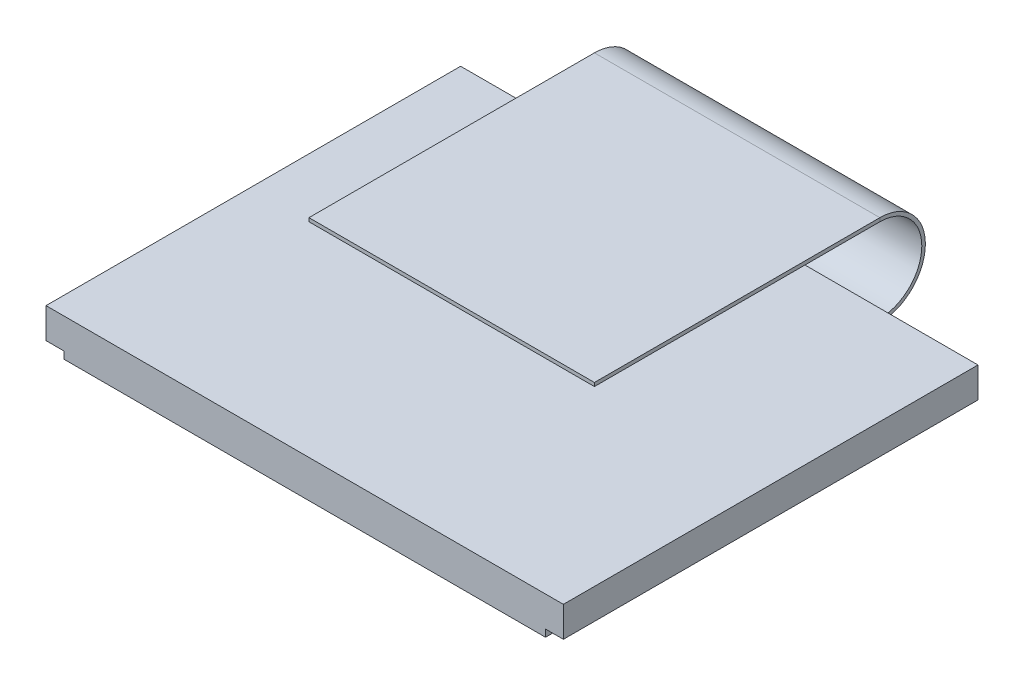
from build123d import *

# Parameters (mm, degrees)
SKETCH2_W           = 14.5
SKETCH2_H           = 11.62
BOSS_EXTRUDE1_DEPTH = 0.425
SKETCH6_W           = 13.5
SKETCH6_H           = 8.1
BOSS_EXTRUDE2_DEPTH = 0.2
SKETCH7_W           = 12.58
SKETCH7_H           = 6.98
BOSS_EXTRUDE3_DEPTH = 0.15
BOSS_EXTRUDE4_DEPTH = 0.17547
FILLET1_R           = 0.762
FILLET2_R           = 0.2
SKETCH13_W          = 8
SKETCH13_H          = 0.1


with BuildPart() as part:
    # Sketch2 → Boss-Extrude1 (new, symmetric)
    with BuildSketch(Plane(origin=(0, 0, 0), x_dir=(1, 0, 0), z_dir=(0, 1, 0))):
        Rectangle(SKETCH2_W, SKETCH2_H)
    extrude(amount=BOSS_EXTRUDE1_DEPTH, both=True)

    # Sketch6 → Boss-Extrude2 (add)
    with BuildSketch(Plane.XZ.offset(0.425)):
        with Locations((0, 1.76)):
            Rectangle(SKETCH6_W, SKETCH6_H)
    extrude(amount=BOSS_EXTRUDE2_DEPTH)

    # Sketch7 → Boss-Extrude3 (add)
    with BuildSketch(Plane.XZ.offset(0.625)):
        with Locations((0, 1.51)):
            Rectangle(SKETCH7_W, SKETCH7_H)
    extrude(amount=BOSS_EXTRUDE3_DEPTH)

    # Sketch9 → Boss-Extrude4 (add)
    with BuildSketch(Plane.XZ.offset(0.425)):
        Polygon((-6.096, -2.452696), (6.096, -2.452696), (6.096, -4.992696), (3.2893, -4.992696), (3.2893, -7.856286), (-3.2893, -7.856286), (-3.2893, -4.992696), (-6.096, -4.992696), align=None)
    extrude(amount=BOSS_EXTRUDE4_DEPTH)

    # Fillet1
    fillet1_edges = [part.edges().sort_by_distance(p)[0] for p in [
        (6.096, -0.512735, -4.992696),
        (-6.096, -0.512735, -4.992696),
    ]]
    fillet(fillet1_edges, radius=FILLET1_R)

    # Fillet2
    fillet2_edges = [part.edges().sort_by_distance(p)[0] for p in [
        (3.2893, -0.512735, -7.856286),
        (-3.2893, -0.512735, -7.856286),
    ]]
    fillet(fillet2_edges, radius=FILLET2_R)

    # Sweep2: sweep along a path in Sketch12
    with BuildLine(Plane(origin=(0, 0, 0), x_dir=(0, 0, -1), z_dir=(1, 0, 0))) as sweep2_path:
        Line((5.81, -0.425), (6.31, -0.425))
        ThreePointArc((6.31, -0.425), (7.585, 0.85), (6.31, 2.125))
        Line((6.31, 2.125), (-1.69, 2.125))
    # Sketch13 → Sweep2 (sweep)
    with BuildSketch(Plane(origin=(0, 0, -5.81), x_dir=(-1, 0, 0), z_dir=(0, 0, -1))):
        with Locations((0, -0.375)):
            Rectangle(SKETCH13_W, SKETCH13_H)
    sweep(path=sweep2_path.line)


solid = part.part
